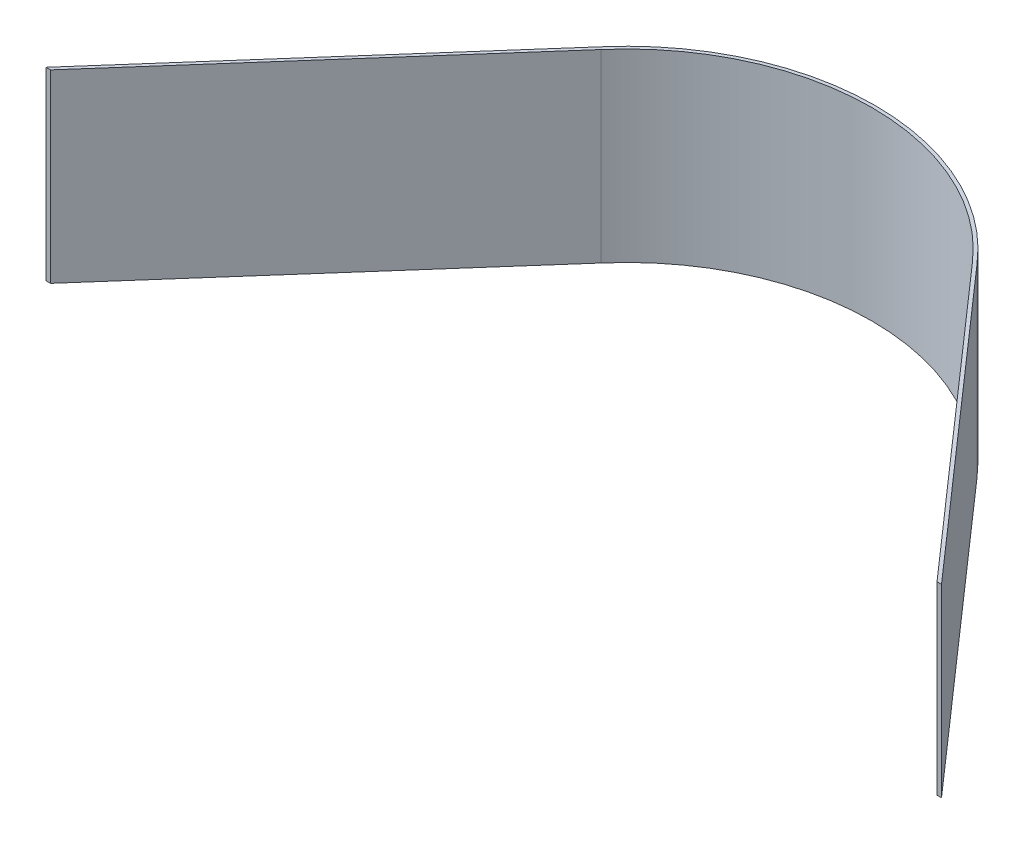
from build123d import *

# Parameters (mm, degrees)
BOSS_EXTRUDE1_DEPTH = 109.600000002


with BuildPart() as part:
    # Sketch1 → Boss-Extrude1 (new body)
    with BuildSketch(Plane(origin=(0, 0, 0), x_dir=(1, 0, 0), z_dir=(0, 1, 0))):
        with BuildLine():
            Line((110, 331.658711753), (261, 160))
            Line((261, 160), (262.7591598, 158))
            Line((262.7591598, 158), (265.422977754, 158))
            Line((265.422977754, 158), (111.509184915, 332.971148344))
            ThreePointArc((111.509184915, 332.971148344), (0, 384.155640476), (-111.509184915, 332.971148344))
            Line((-111.509184915, 332.971148344), (-265.422977754, 158))
            Line((-265.422977754, 158), (-262.759304826, 158))
            Line((-262.759304826, 158), (-261, 160))
            Line((-261, 160), (-258.79140534, 162.510758371))
            Line((-258.79140534, 162.510758371), (-110, 331.658711753))
            ThreePointArc((-110, 331.658711753), (0, 382.155640476), (110, 331.658711753))
        make_face()
    extrude(amount=BOSS_EXTRUDE1_DEPTH)


solid = part.part
